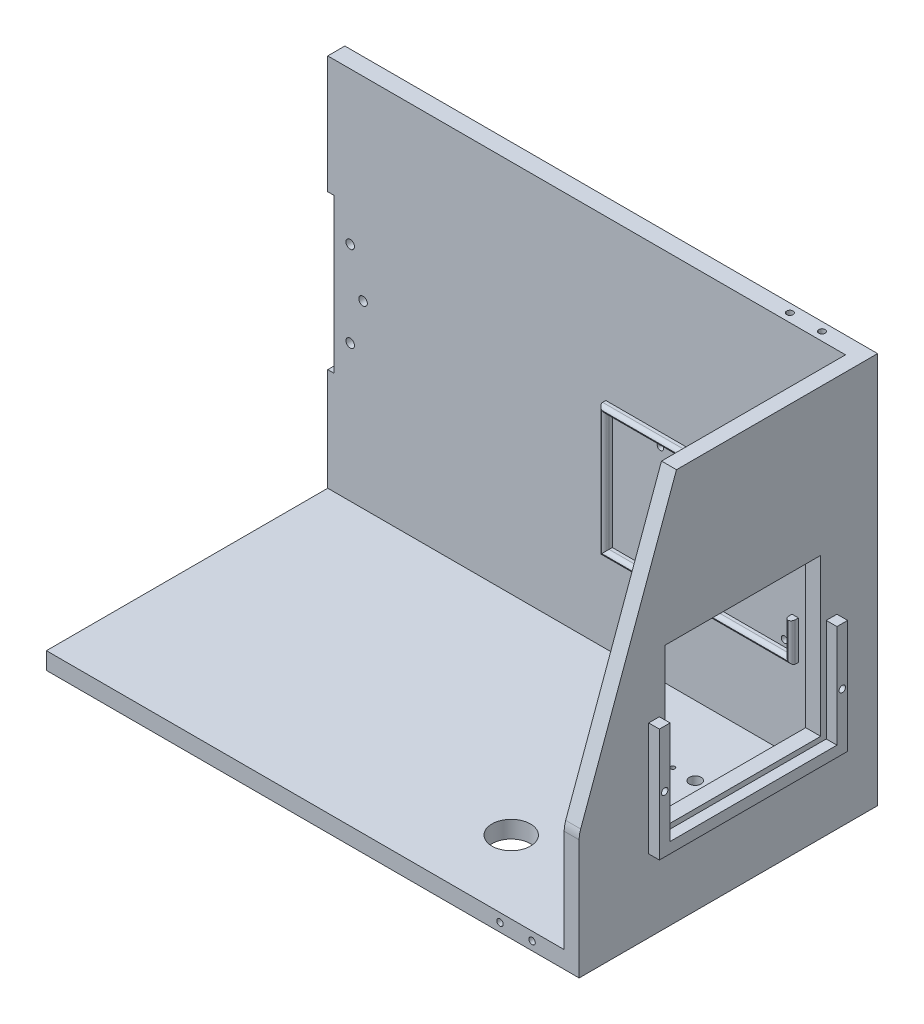
from build123d import *

# Parameters (mm, degrees)
SKETCH1_W            = 170
SKETCH1_H            = 130
BOSS_EXTRUDE1_DEPTH  = 8
SKETCH2_R            = 1.5
SKETCH2_W            = 165
SKETCH2_H            = 100
CUT_EXTRUDE1_DEPTH   = 21
SKETCH3_W            = 170
SKETCH3_H            = 20
BOSS_EXTRUDE2_DEPTH  = 8
SKETCH4_W            = 65
SKETCH4_H            = 16.2
CUT_EXTRUDE2_DEPTH   = 2
SKETCH5_W            = 3.5
SKETCH5_H            = 12
CUT_EXTRUDE3_DEPTH   = 35
SKETCH6_W            = 170
SKETCH6_H            = 150
BOSS_EXTRUDE3_DEPTH  = 8
BOSS_EXTRUDE4_DEPTH  = 138
SKETCH8_W            = 249
SKETCH8_H            = 138
BOSS_EXTRUDE5_DEPTH  = 1
SKETCH9_W            = 72.8
SKETCH9_H            = 73.25
CUT_EXTRUDE4_DEPTH   = 19
BOSS_EXTRUDE6_DEPTH  = 5
SKETCH11_R           = 1.5
CUT_EXTRUDE5_DEPTH   = 56
SKETCH12_R           = 9
SKETCH12_R_2         = 6.5
SKETCH12_R_3         = 1
SKETCH12_R_4         = 2.75
CUT_EXTRUDE6_DEPTH   = 115
SKETCH13_W           = 58.59049163
SKETCH13_H           = 30.075830986
CUT_EXTRUDE7_DEPTH   = 3
FILLET1_R            = 2
SKETCH15_R           = 1.5
CUT_EXTRUDE8_DEPTH   = 10
CUT_EXTRUDE10_DEPTH  = 261
SKETCH19_R           = 1.5
BOSS_EXTRUDE7_DEPTH  = 8
BOSS_EXTRUDE12_START = -124.5
BOSS_EXTRUDE12_DEPTH = 249
SKETCH22_R           = 1.5
SKETCH22_W           = 165
SKETCH22_H           = 100
CUT_EXTRUDE11_DEPTH  = 18
FILLET2_R            = 10
SKETCH23_R           = 1.5
CUT_EXTRUDE12_DEPTH  = 42
SKETCH24_R           = 2
SKETCH24_W           = 3
SKETCH24_H           = 72
CUT_EXTRUDE15_DEPTH  = 42
FILLET3_R            = 2
SKETCH25_W           = 242
SKETCH25_H           = 175
CUT_EXTRUDE16_DEPTH  = 173
SKETCH26_W           = 249
SKETCH26_H           = 183
BOSS_EXTRUDE13_DEPTH = 8
SKETCH27_R           = 1.5
CUT_EXTRUDE17_DEPTH  = 25
SKETCH29_W           = 90
SKETCH29_H           = 61
SKETCH29_W_2         = 84
SKETCH29_H_2         = 55
BOSS_EXTRUDE15_DEPTH = 3.5
SKETCH30_W           = 3
SKETCH30_H           = 25
CUT_EXTRUDE18_DEPTH  = 3.5
FILLET4_R            = 2
SKETCH32_R           = 2
SKETCH32_W           = 3
SKETCH32_H           = 72
CUT_EXTRUDE19_DEPTH  = 41
CUT_EXTRUDE23_START  = -289
CUT_EXTRUDE23_DEPTH  = 289
SKETCH38_R           = 1.5
CUT_EXTRUDE24_DEPTH  = 20
SKETCH39_R           = 1.5
CUT_EXTRUDE25_DEPTH  = 20


with BuildPart() as part:
    # Sketch1 → Boss-Extrude1 (new body)
    with BuildSketch(Plane.XY):
        with Locations((85, 65)):
            Rectangle(SKETCH1_W, SKETCH1_H)
    extrude(amount=BOSS_EXTRUDE1_DEPTH)

    # Sketch2 → Cut-Extrude1 (cut)
    with BuildSketch(Plane.XY.offset(8)):
        with Locations((6.55, 123.35)):
            Circle(SKETCH2_R)
        with Locations((163.45, 123.35)):
            Circle(SKETCH2_R)
        with Locations((6.55, 6.65)):
            Circle(SKETCH2_R)
        with Locations((163.45, 6.65)):
            Circle(SKETCH2_R)
        with Locations((85, 65)):
            Rectangle(SKETCH2_W, SKETCH2_H)
    extrude(amount=-CUT_EXTRUDE1_DEPTH, mode=Mode.SUBTRACT)

    # Sketch3 → Boss-Extrude2 (add)
    with BuildSketch(Plane.XY.offset(8)):
        with Locations((85, -10)):
            Rectangle(SKETCH3_W, SKETCH3_H)
    extrude(amount=-BOSS_EXTRUDE2_DEPTH)

    # Sketch4 → Cut-Extrude2 (cut)
    with BuildSketch(Plane.XY.offset(8)):
        with Locations((85, -10)):
            Rectangle(SKETCH4_W, SKETCH4_H)
    extrude(amount=-CUT_EXTRUDE2_DEPTH, mode=Mode.SUBTRACT)

    # Sketch5 → Cut-Extrude3 (cut)
    with BuildSketch(Plane.XY.offset(6)):
        with Locations((63.25, -10)):
            Rectangle(SKETCH5_W, SKETCH5_H)
        with Locations((71.75, -10)):
            Rectangle(SKETCH5_W, SKETCH5_H)
        with Locations((80.75, -10)):
            Rectangle(SKETCH5_W, SKETCH5_H)
        with Locations((89.25, -10)):
            Rectangle(SKETCH5_W, SKETCH5_H)
        with Locations((98.25, -10)):
            Rectangle(SKETCH5_W, SKETCH5_H)
        with Locations((106.75, -10)):
            Rectangle(SKETCH5_W, SKETCH5_H)
    extrude(amount=-CUT_EXTRUDE3_DEPTH, mode=Mode.SUBTRACT)

    # Sketch6 → Boss-Extrude3 (add)
    with BuildSketch(Plane.XY.offset(8)):
        Polygon((15.504384948, 140), (225, 140), (225, -35), (-10, -35), (-10, 140), align=None)
        with Locations((85, 55)):
            Rectangle(SKETCH6_W, SKETCH6_H, mode=Mode.SUBTRACT)
    extrude(amount=-BOSS_EXTRUDE3_DEPTH)

    # Sketch7 → Boss-Extrude4 (add)
    with BuildSketch(Plane.XY.offset(8)):
        Polygon((-10, 140), (-17, 140), (-17, -42), (232, -42), (232, 140), (225, 140), (225, -35), (-10, -35), align=None)
    extrude(amount=-BOSS_EXTRUDE4_DEPTH)

    # Sketch8 → Boss-Extrude5 (add)
    with BuildSketch(Plane.XZ.offset(42)):
        with Locations((107.5, -61)):
            Rectangle(SKETCH8_W, SKETCH8_H)
    extrude(amount=BOSS_EXTRUDE5_DEPTH)

    # Sketch9 → Cut-Extrude4 (cut)
    with BuildSketch(Plane(origin=(232, 0, 0), x_dir=(0, 0, -1), z_dir=(1, 0, 0))):
        with Locations((75, 35)):
            Rectangle(SKETCH9_W, SKETCH9_H)
    extrude(amount=-CUT_EXTRUDE4_DEPTH, mode=Mode.SUBTRACT)

    # Sketch10 → Boss-Extrude6 (add)
    with BuildSketch(Plane(origin=(232, 0, 0), x_dir=(0, 0, -1), z_dir=(1, 0, 0))):
        Polygon((36, 44), (36, -4), (114, -4), (114, 44), (119, 44), (119, -9), (31, -9), (31, 44), align=None)
    extrude(amount=BOSS_EXTRUDE6_DEPTH)

    # Sketch11 → Cut-Extrude5 (cut)
    with BuildSketch(Plane(origin=(237, 0, 0), x_dir=(0, 0, -1), z_dir=(1, 0, 0))):
        with Locations((33.5, 17.5)):
            Circle(SKETCH11_R)
        with Locations((116.5, 17.5)):
            Circle(SKETCH11_R)
    extrude(amount=-CUT_EXTRUDE5_DEPTH, mode=Mode.SUBTRACT)

    # Sketch12 → Cut-Extrude6 (cut)
    with BuildSketch(Plane(origin=(0, -35, 0), x_dir=(1, 0, 0), z_dir=(0, 1, 0))):
        with Locations(Location((166.25, 32.5, 0), (0, 0, 180))):
            Circle(SKETCH12_R)
        with Locations(Location((166.25, 97.5, 0), (0, 0, 180))):
            Circle(SKETCH12_R_2)
        with Locations(Location((155.75, 97.5, 0), (0, 0, 180))):
            Circle(SKETCH12_R_3)
        with Locations(Location((155.75, 85, 0), (0, 0, 180))):
            Circle(SKETCH12_R_3)
        with Locations(Location((176.75, 85, 0), (0, 0, 180))):
            Circle(SKETCH12_R_3)
        with Locations(Location((176.75, 97.5, 0), (0, 0, 180))):
            Circle(SKETCH12_R_3)
        with Locations(Location((145.25, 97.5, 0), (0, 0, 180))):
            Circle(SKETCH12_R_4)
        with Locations(Location((187.25, 97.5, 0), (0, 0, 180))):
            Circle(SKETCH12_R_4)
    extrude(amount=-CUT_EXTRUDE6_DEPTH, mode=Mode.SUBTRACT)

    # Sketch13 → Cut-Extrude7 (cut)
    with BuildSketch(Plane.XZ.offset(43)):
        with Locations((166.25, -93.48757215)):
            Rectangle(SKETCH13_W, SKETCH13_H)
    extrude(amount=-CUT_EXTRUDE7_DEPTH, mode=Mode.SUBTRACT)

    # Fillet1
    fillet1_edges = [part.edges().sort_by_distance(p)[0] for p in [
        (136.954754185, -40, -93.48757215),
        (166.25, -40, -78.449656657),
        (195.545245815, -40, -93.48757215),
        (166.25, -40, -108.525487643),
    ]]
    fillet(fillet1_edges, radius=FILLET1_R)

    # Sketch15 → Cut-Extrude8 (cut)
    with BuildSketch(Plane(origin=(0, 140, 0), x_dir=(1, 0, 0), z_dir=(0, 1, 0))):
        with Locations(Location((5, -4, 0), (0, 0, 270))):
            Circle(SKETCH15_R)
        with Locations(Location((20, -4, 0), (0, 0, 270))):
            Circle(SKETCH15_R)
        with Locations(Location((217, -4, 0), (0, 0, 90))):
            Circle(SKETCH15_R)
        with Locations(Location((202, -4, 0), (0, 0, 90))):
            Circle(SKETCH15_R)
    extrude(amount=-CUT_EXTRUDE8_DEPTH, mode=Mode.SUBTRACT)

    # Sketch18 → Cut-Extrude10 (cut)
    with BuildSketch(Plane(origin=(232, 0, 0), x_dir=(0, 0, -1), z_dir=(1, 0, 0))):
        Polygon((45.496279283, 140), (-8, 140), (-8, 15), (0, 15), align=None)
    extrude(amount=-CUT_EXTRUDE10_DEPTH, mode=Mode.SUBTRACT)

    # Sketch19 → Boss-Extrude7 (add)
    with BuildSketch(Plane.XY.offset(8)):
        with Locations((6.55, 6.65)):
            Circle(SKETCH19_R)
        with Locations((163.45, 6.65)):
            Circle(SKETCH19_R)
    extrude(amount=-BOSS_EXTRUDE7_DEPTH)

    # Sketch21 → Boss-Extrude12 (add)
    with BuildSketch(Plane(origin=(107.5, 0, 0), x_dir=(0, 0, -1), z_dir=(1, 0, 0)).offset(BOSS_EXTRUDE12_START)):
        Polygon((45.496279283, 140), (0, 15), (-8, 15), (37.496279283, 140), align=None)
    extrude(amount=BOSS_EXTRUDE12_DEPTH)

    # Sketch22 → Cut-Extrude11 (cut)
    with BuildSketch(Plane(origin=(0, 4.325817115, 11.885084845), x_dir=(1, 0, 0), z_dir=(0, 0.3420201433256603, 0.9396926207859115))):
        with Locations(Location((1.55, 136.220338945, 0), (0, 0, 270))):
            Circle(SKETCH22_R)
        with Locations(Location((158.45, 136.220338945, 0), (0, 0, 270))):
            Circle(SKETCH22_R)
        with Locations(Location((1.55, 19.520338945, 0), (0, 0, 270))):
            Circle(SKETCH22_R)
        with Locations(Location((158.45, 19.520338945, 0), (0, 0, 270))):
            Circle(SKETCH22_R)
        with Locations((80, 77.870338945)):
            Rectangle(SKETCH22_W, SKETCH22_H)
    extrude(amount=-CUT_EXTRUDE11_DEPTH, mode=Mode.SUBTRACT)

    # Fillet2
    fillet2_edges = [part.edges().sort_by_distance(p)[0] for p in [
        (107.5, 15, 8),
    ]]
    fillet(fillet2_edges, radius=FILLET2_R)

    # Sketch23 → Cut-Extrude12 (cut)
    with BuildSketch(Plane(origin=(0, 140, 0), x_dir=(1, 0, 0), z_dir=(0, 1, 0))):
        with Locations(Location((20, 41.496279283, 0), (0, 0, 270))):
            Circle(SKETCH23_R)
        with Locations(Location((217, 41.496279283, 0), (0, 0, 270))):
            Circle(SKETCH23_R)
        with Locations(Location((202, 41.496279283, 0), (0, 0, 270))):
            Circle(SKETCH23_R)
    extrude(amount=-CUT_EXTRUDE12_DEPTH, mode=Mode.SUBTRACT)

    # Sketch24 → Cut-Extrude15 (cut)
    with BuildSketch(Plane(origin=(-10, 0, 0), x_dir=(0, 0, -1), z_dir=(1, 0, 0))):
        with Locations(Location((113.5, 48.5, 0), (0, 0, 90))):
            Circle(SKETCH24_R)
        with Locations(Location((119.5, 68.5, 0), (0, 0, 90))):
            Circle(SKETCH24_R)
        with Locations(Location((119.5, 28.5, 0), (0, 0, 90))):
            Circle(SKETCH24_R)
        with Locations((128.5, 48.5)):
            Rectangle(SKETCH24_W, SKETCH24_H)
    extrude(amount=-CUT_EXTRUDE15_DEPTH, mode=Mode.SUBTRACT)

    # Fillet3
    fillet3_edges = [part.edges().sort_by_distance(p)[0] for p in [
        (-13.5, 84.5, -130),
        (-13.5, 12.5, -130),
        (-17, 48.5, -127),
        (-17, 12.5, -128.5),
        (-17, 84.5, -128.5),
        (-10, 84.5, -128.5),
        (-10, 48.5, -127),
        (-10, 12.5, -128.5),
    ]]
    fillet(fillet3_edges, radius=FILLET3_R)

    # Sketch25 → Cut-Extrude16 (cut)
    with BuildSketch(Plane.XY.offset(8)):
        with Locations((104, 52.5)):
            Rectangle(SKETCH25_W, SKETCH25_H)
    extrude(amount=-CUT_EXTRUDE16_DEPTH, mode=Mode.SUBTRACT)

    # Sketch26 → Boss-Extrude13 (add)
    with BuildSketch(Plane(origin=(0, 0, -130), x_dir=(-1, 0, 0), z_dir=(0, 0, -1))):
        with Locations((-107.5, 48.5)):
            Rectangle(SKETCH26_W, SKETCH26_H)
    extrude(amount=BOSS_EXTRUDE13_DEPTH)

    # Sketch27 → Cut-Extrude17 (cut)
    with BuildSketch(Plane.XY.offset(-130)):
        with Locations((138.5, 59.5)):
            Circle(SKETCH27_R)
        with Locations((138.5, 10.5)):
            Circle(SKETCH27_R)
        with Locations((196.5, 59.5)):
            Circle(SKETCH27_R)
        with Locations((196.5, 10.5)):
            Circle(SKETCH27_R)
    extrude(amount=-CUT_EXTRUDE17_DEPTH, mode=Mode.SUBTRACT)

    # Sketch29 → Boss-Extrude15 (add)
    with BuildSketch(Plane.XY.offset(-130)):
        with Locations((158, 35)):
            Rectangle(SKETCH29_W, SKETCH29_H)
        with Locations((158, 35)):
            Rectangle(SKETCH29_W_2, SKETCH29_H_2, mode=Mode.SUBTRACT)
    extrude(amount=BOSS_EXTRUDE15_DEPTH)

    # Sketch30 → Cut-Extrude18 (cut)
    with BuildSketch(Plane.XY.offset(-126.5)):
        with Locations((201.5, 35)):
            Rectangle(SKETCH30_W, SKETCH30_H)
    extrude(amount=-CUT_EXTRUDE18_DEPTH, mode=Mode.SUBTRACT)

    # Fillet4
    # the kernel refuses this fillet: 2 mm, written as the material it takes off along each edge
    with BuildSketch(Plane(origin=(113, -0.5, -126.5), x_dir=(0, 0, -1), z_dir=(0, 1, 0))) as fillet4_piece_1:
        with BuildLine():
            CenterArc((FILLET4_R, -FILLET4_R), FILLET4_R, 90, 90)
            Line((0, -FILLET4_R), (0, 0))
            Line((0, 0), (FILLET4_R, 0))
        make_face()
    extrude(amount=71, mode=Mode.SUBTRACT)
    with BuildSketch(Plane(origin=(203, 27.5, -126.5), x_dir=(0, 0, -1), z_dir=(0, -1, 0)), Plane(origin=(203, 70.5, -126.5), x_dir=(0, 0, -1), z_dir=(0, -1, 0))) as fillet4_piece_2:
        with BuildLine():
            CenterArc((FILLET4_R, -FILLET4_R), FILLET4_R, 90, 90)
            Line((0, -FILLET4_R), (0, 0))
            Line((0, 0), (FILLET4_R, 0))
        make_face()
    extrude(amount=28, mode=Mode.SUBTRACT)
    with BuildSketch(Plane(origin=(200, 27.5, -126.5), x_dir=(1, 0, 0), z_dir=(0, -1, 0)), Plane(origin=(200, 62.5, -126.5), x_dir=(1, 0, 0), z_dir=(0, -1, 0))) as fillet4_piece_3:
        with BuildLine():
            CenterArc((FILLET4_R, -FILLET4_R), FILLET4_R, 90, 90)
            Line((0, -FILLET4_R), (0, 0))
            Line((0, 0), (FILLET4_R, 0))
        make_face()
    extrude(amount=20, mode=Mode.SUBTRACT)
    with BuildSketch(Plane(origin=(108, 65.5, -126.5), x_dir=(0, 0, -1), z_dir=(1, 0, 0)), Plane(origin=(208, 4.5, -126.5), x_dir=(0, 0, -1), z_dir=(-1, 0, 0))) as fillet4_piece_4:
        with BuildLine():
            CenterArc((FILLET4_R, -FILLET4_R), FILLET4_R, 90, 90)
            Line((0, -FILLET4_R), (0, 0))
            Line((0, 0), (FILLET4_R, 0))
        make_face()
    extrude(amount=100, mode=Mode.SUBTRACT)
    with BuildSketch(Plane(origin=(200, 7.5, -126.5), x_dir=(0, -1, 0), z_dir=(-1, 0, 0)), Plane(origin=(116, 62.5, -126.5), x_dir=(0, 1, 0), z_dir=(1, 0, 0))) as fillet4_piece_5:
        with BuildLine():
            CenterArc((FILLET4_R, -FILLET4_R), FILLET4_R, 90, 90)
            Line((0, -FILLET4_R), (0, 0))
            Line((0, 0), (FILLET4_R, 0))
        make_face()
    extrude(amount=84, mode=Mode.SUBTRACT)
    with BuildSketch(Plane(origin=(116, 7.5, -126.5), x_dir=(-1, 0, 0), z_dir=(0, 1, 0))) as fillet4_piece_6:
        with BuildLine():
            CenterArc((FILLET4_R, -FILLET4_R), FILLET4_R, 90, 90)
            Line((0, -FILLET4_R), (0, 0))
            Line((0, 0), (FILLET4_R, 0))
        make_face()
    extrude(amount=55, mode=Mode.SUBTRACT)
    with BuildSketch(Plane(origin=(200, 27.5, -126.5), x_dir=(1, 0, 0), z_dir=(0, -1, 0))) as fillet4_piece_7a_section:
        with BuildLine():
            CenterArc((FILLET4_R, -FILLET4_R), FILLET4_R, 90, 90)
            Line((0, -FILLET4_R), (0, 0))
            Line((0, 0), (FILLET4_R, 0))
        make_face()
    fillet4_piece_7a = extrude(amount=25, mode=Mode.PRIVATE)
    fillet4_piece_7a = split(fillet4_piece_7a, bisect_by=Plane(origin=(200.452790229, 7.5, -126.952790229), z_dir=(0, -1, 0)), keep=Keep.TOP, mode=Mode.PRIVATE)
    with BuildSketch(Plane(origin=(205, 7.5, -126.5), x_dir=(0, -1, 0), z_dir=(-1, 0, 0))) as fillet4_piece_7b_section:
        with BuildLine():
            CenterArc((FILLET4_R, -FILLET4_R), FILLET4_R, 90, 90)
            Line((0, -FILLET4_R), (0, 0))
            Line((0, 0), (FILLET4_R, 0))
        make_face()
    fillet4_piece_7b = extrude(amount=89, mode=Mode.PRIVATE)
    fillet4_piece_7b = split(fillet4_piece_7b, bisect_by=Plane(origin=(200, 7.047209771, -126.952790229), z_dir=(1, 0, 0)), keep=Keep.TOP, mode=Mode.PRIVATE)
    fillet4_piece_7 = fillet4_piece_7a & fillet4_piece_7b
    add(fillet4_piece_7, mode=Mode.SUBTRACT)
    with BuildSketch(Plane(origin=(116, 62.5, -126.5), x_dir=(0, 1, 0), z_dir=(1, 0, 0))) as fillet4_piece_8a_section:
        with BuildLine():
            CenterArc((FILLET4_R, -FILLET4_R), FILLET4_R, 90, 90)
            Line((0, -FILLET4_R), (0, 0))
            Line((0, 0), (FILLET4_R, 0))
        make_face()
    fillet4_piece_8a = extrude(amount=89, mode=Mode.PRIVATE)
    fillet4_piece_8a = split(fillet4_piece_8a, bisect_by=Plane(origin=(200, 62.952790229, -126.952790229), z_dir=(1, 0, 0)), keep=Keep.TOP, mode=Mode.PRIVATE)
    with BuildSketch(Plane(origin=(200, 67.5, -126.5), x_dir=(1, 0, 0), z_dir=(0, -1, 0))) as fillet4_piece_8b_section:
        with BuildLine():
            CenterArc((FILLET4_R, -FILLET4_R), FILLET4_R, 90, 90)
            Line((0, -FILLET4_R), (0, 0))
            Line((0, 0), (FILLET4_R, 0))
        make_face()
    fillet4_piece_8b = extrude(amount=25, mode=Mode.PRIVATE)
    fillet4_piece_8b = split(fillet4_piece_8b, bisect_by=Plane(origin=(200.452790229, 62.5, -126.952790229), z_dir=(0, 1, 0)), keep=Keep.TOP, mode=Mode.PRIVATE)
    fillet4_piece_8 = fillet4_piece_8a & fillet4_piece_8b
    add(fillet4_piece_8, mode=Mode.SUBTRACT)
    with BuildSketch(Plane(origin=(200, 7.5, -126.5), x_dir=(0, -1, 0), z_dir=(-1, 0, 0))) as fillet4_piece_9a_section:
        with BuildLine():
            CenterArc((FILLET4_R, -FILLET4_R), FILLET4_R, 90, 90)
            Line((0, -FILLET4_R), (0, 0))
            Line((0, 0), (FILLET4_R, 0))
        make_face()
    fillet4_piece_9a = extrude(amount=89, mode=Mode.PRIVATE)
    fillet4_piece_9a = split(fillet4_piece_9a, bisect_by=Plane(origin=(116, 7.047209771, -126.952790229), z_dir=(-1, 0, 0)), keep=Keep.TOP, mode=Mode.PRIVATE)
    with BuildSketch(Plane(origin=(116, 2.5, -126.5), x_dir=(-1, 0, 0), z_dir=(0, 1, 0))) as fillet4_piece_9b_section:
        with BuildLine():
            CenterArc((FILLET4_R, -FILLET4_R), FILLET4_R, 90, 90)
            Line((0, -FILLET4_R), (0, 0))
            Line((0, 0), (FILLET4_R, 0))
        make_face()
    fillet4_piece_9b = extrude(amount=60, mode=Mode.PRIVATE)
    fillet4_piece_9b = split(fillet4_piece_9b, bisect_by=Plane(origin=(115.547209771, 7.5, -126.952790229), z_dir=(0, -1, 0)), keep=Keep.TOP, mode=Mode.PRIVATE)
    fillet4_piece_9 = fillet4_piece_9a & fillet4_piece_9b
    add(fillet4_piece_9, mode=Mode.SUBTRACT)
    with BuildSketch(Plane(origin=(116, 7.5, -126.5), x_dir=(-1, 0, 0), z_dir=(0, 1, 0))) as fillet4_piece_10a_section:
        with BuildLine():
            CenterArc((FILLET4_R, -FILLET4_R), FILLET4_R, 90, 90)
            Line((0, -FILLET4_R), (0, 0))
            Line((0, 0), (FILLET4_R, 0))
        make_face()
    fillet4_piece_10a = extrude(amount=60, mode=Mode.PRIVATE)
    fillet4_piece_10a = split(fillet4_piece_10a, bisect_by=Plane(origin=(115.547209771, 62.5, -126.952790229), z_dir=(0, 1, 0)), keep=Keep.TOP, mode=Mode.PRIVATE)
    with BuildSketch(Plane(origin=(111, 62.5, -126.5), x_dir=(0, 1, 0), z_dir=(1, 0, 0))) as fillet4_piece_10b_section:
        with BuildLine():
            CenterArc((FILLET4_R, -FILLET4_R), FILLET4_R, 90, 90)
            Line((0, -FILLET4_R), (0, 0))
            Line((0, 0), (FILLET4_R, 0))
        make_face()
    fillet4_piece_10b = extrude(amount=89, mode=Mode.PRIVATE)
    fillet4_piece_10b = split(fillet4_piece_10b, bisect_by=Plane(origin=(116, 62.952790229, -126.952790229), z_dir=(-1, 0, 0)), keep=Keep.TOP, mode=Mode.PRIVATE)
    fillet4_piece_10 = fillet4_piece_10a & fillet4_piece_10b
    add(fillet4_piece_10, mode=Mode.SUBTRACT)

    # Sketch32 → Cut-Extrude19 (cut)
    with BuildSketch(Plane.XY.offset(-130)):
        with Locations((-6.5, 69)):
            Circle(SKETCH32_R)
        with Locations((-6.5, 29)):
            Circle(SKETCH32_R)
        with Locations((-0.5, 49)):
            Circle(SKETCH32_R)
        with Locations((-15.5, 49)):
            Rectangle(SKETCH32_W, SKETCH32_H)
    extrude(amount=-CUT_EXTRUDE19_DEPTH, mode=Mode.SUBTRACT)

    # Sketch37 → Cut-Extrude23 (cut)
    with BuildSketch(Plane(origin=(232, 0, 0), x_dir=(0, 0, -1), z_dir=(1, 0, 0)).offset(CUT_EXTRUDE23_START)):
        with BuildLine():
            Line((37.496279283, 140), (43.996279283, 140))
            Line((43.996279283, 140), (-0.786907643, 16.959205149))
            ThreePointArc((-0.786907643, 16.959205149), (-1.320362361, 14.968325037), (-1.5, 12.915057428))
            Line((-1.5, 12.915057428), (-1.5, -43))
            Line((-1.5, -43), (-8, -43))
            Line((-8, -43), (-8, 13.236730193))
            ThreePointArc((-8, 13.236730193), (-7.84807753, 14.97321197), (-7.396926208, 16.656931626))
            Line((-7.396926208, 16.656931626), (37.496279283, 140))
        make_face()
    extrude(amount=CUT_EXTRUDE23_DEPTH, mode=Mode.SUBTRACT)

    # Sketch38 → Cut-Extrude24 (cut)
    with BuildSketch(Plane(origin=(0, 140, 0), x_dir=(1, 0, 0), z_dir=(0, 1, 0))):
        with Locations(Location((210, 134, 0), (0, 0, 270))):
            Circle(SKETCH38_R)
        with Locations(Location((195, 134, 0), (0, 0, 270))):
            Circle(SKETCH38_R)
    extrude(amount=-CUT_EXTRUDE24_DEPTH, mode=Mode.SUBTRACT)

    # Sketch39 → Cut-Extrude25 (cut)
    with BuildSketch(Plane.XY.offset(1.5)):
        with Locations((210, -39)):
            Circle(SKETCH39_R)
        with Locations((195, -39)):
            Circle(SKETCH39_R)
    extrude(amount=-CUT_EXTRUDE25_DEPTH, mode=Mode.SUBTRACT)


solid = part.part
